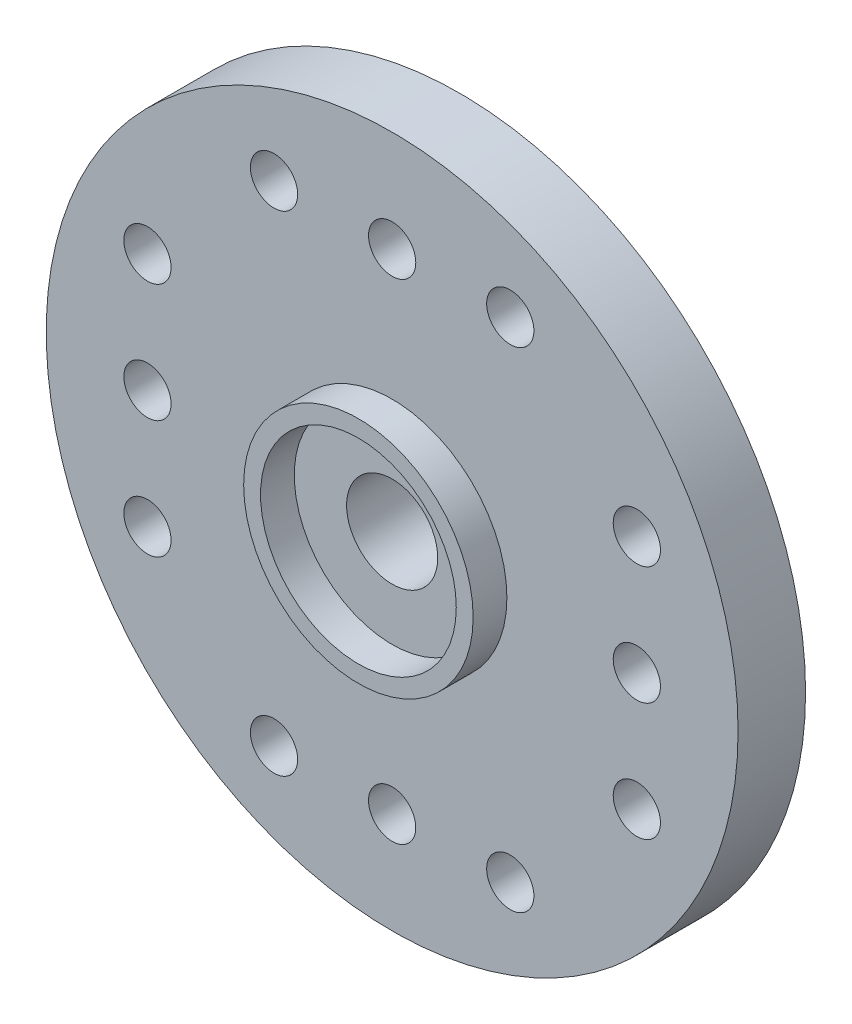
from build123d import *

# Parameters (mm, degrees)
SKETCH1_R           = 10.25
BOSS_EXTRUDE1_DEPTH = 2
SKETCH2_R           = 3.4
SKETCH2_R_2         = 2.9
BOSS_EXTRUDE2_DEPTH = 1
SKETCH3_R           = 1.35
CUT_EXTRUDE1_DEPTH  = 15.633010627
SKETCH4_R           = 0.7
CUT_EXTRUDE2_DEPTH  = 15.633010627
CIRPATTERN1_COUNT   = 4
SKETCH5_R           = 4.85
SKETCH5_R_2         = 2.7
BOSS_EXTRUDE3_DEPTH = 3


with BuildPart() as part:
    # Sketch1 → Boss-Extrude1 (new body)
    with BuildSketch(Plane.XY):
        Circle(SKETCH1_R)
    extrude(amount=BOSS_EXTRUDE1_DEPTH)

    # Sketch2 → Boss-Extrude2 (add)
    with BuildSketch(Plane.XY.offset(2)):
        Circle(SKETCH2_R)
        Circle(SKETCH2_R_2, mode=Mode.SUBTRACT)
    extrude(amount=BOSS_EXTRUDE2_DEPTH)

    # Sketch3 → Cut-Extrude1 (cut, through all)
    with BuildSketch(Plane.XY.offset(2)):
        Circle(SKETCH3_R)
    extrude(amount=-CUT_EXTRUDE1_DEPTH, mode=Mode.SUBTRACT)

    # Sketch4 → Cut-Extrude2 (cut, through all)
    with BuildSketch(Plane.XY.offset(2)):
        with Locations((0, 7.25)):
            Circle(SKETCH4_R)
        with Locations((3.5, 7.25)):
            Circle(SKETCH4_R)
        with Locations((-3.5, 7.25)):
            Circle(SKETCH4_R)
        with Locations((-3.5, -7.25)):
            Circle(SKETCH4_R)
        with Locations((3.5, -7.25)):
            Circle(SKETCH4_R)
        with Locations((0, -7.25)):
            Circle(SKETCH4_R)
    cut_extrude2 = extrude(amount=-CUT_EXTRUDE2_DEPTH, mode=Mode.SUBTRACT)

    # CirPattern1: Cut-Extrude2 ×4 about axis
    cirpattern1_axis = Axis((0, 0, 2), (0, 0, -1))
    for i in range(1, CIRPATTERN1_COUNT):
        add(cut_extrude2.rotate(cirpattern1_axis, i * 360 / CIRPATTERN1_COUNT), mode=Mode.SUBTRACT)

    # Sketch5 → Boss-Extrude3 (add)
    with BuildSketch(Plane(origin=(0, 0, 0), x_dir=(-1, 0, 0), z_dir=(0, 0, -1))):
        Circle(SKETCH5_R)
        Circle(SKETCH5_R_2, mode=Mode.SUBTRACT)
    extrude(amount=BOSS_EXTRUDE3_DEPTH)


solid = part.part
